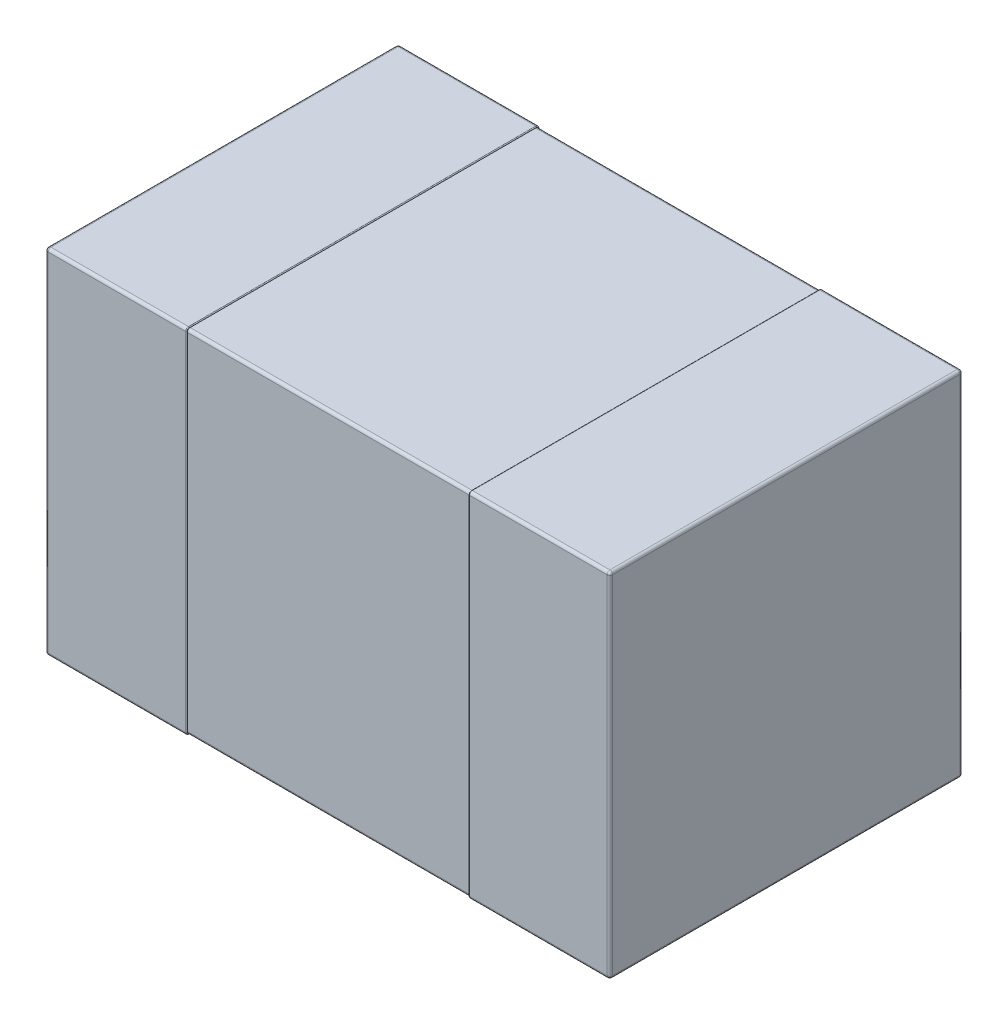
from build123d import *

# Parameters (mm, degrees)
SKETCH1_W                           = 2
SKETCH1_H                           = 1.25
ALL_BODY_DEPTH                      = 1.25
CUT_OUT_THE_BODY_FOR_PIN_DEPTH      = 0.5
CUT_OUT_THE_BODY_FOR_PIN_DEPTH_BACK = 0.5
SKETCH2_OUTSIDE_W                   = 3.784
SKETCH2_OUTSIDE_H                   = 3.784
SKETCH2_OUTSIDE_W_2                 = 1.244
SKETCH2_OUTSIDE_H_2                 = 1.244
BODY_FILLET_R                       = 0.01
PIN_FILLET_A_R                      = 0.01
PIN_FILLET_B_R                      = 0.003


with BuildPart() as part:
    # Sketch1 → All body (new body)
    with BuildSketch(Plane.XY):
        Rectangle(SKETCH1_W, SKETCH1_H)
    extrude(amount=ALL_BODY_DEPTH)

    # Sketch2 outside → Cut out the body for pin (cut, two sides: drawn at the far end of the back side and taken through both)
    with BuildSketch(Plane(origin=(0, 0, 0), x_dir=(0, 0, -1), z_dir=(1, 0, 0)).offset(-CUT_OUT_THE_BODY_FOR_PIN_DEPTH_BACK)):
        with Locations((-0.625, 0)):
            Rectangle(SKETCH2_OUTSIDE_W, SKETCH2_OUTSIDE_H)
        with Locations((-0.625, 0)):
            Rectangle(SKETCH2_OUTSIDE_W_2, SKETCH2_OUTSIDE_H_2, mode=Mode.SUBTRACT)
    extrude(amount=CUT_OUT_THE_BODY_FOR_PIN_DEPTH + CUT_OUT_THE_BODY_FOR_PIN_DEPTH_BACK, mode=Mode.SUBTRACT)

    # Body fillet
    body_fillet_edges = [part.edges().sort_by_distance(p)[0] for p in [
        (0, 0.622, 0.003),
        (0, 0.622, 1.247),
        (0, -0.622, 1.247),
        (0, -0.622, 0.003),
    ]]
    fillet(body_fillet_edges, radius=BODY_FILLET_R)

    # Pin fillet a
    pin_fillet_a_edges = [part.edges().sort_by_distance(p)[0] for p in [
        (1, 0, 1.25),
        (-0.75, 0.625, 0),
        (0.75, -0.625, 0),
        (0.75, -0.625, 1.25),
        (-0.75, 0.625, 1.25),
        (0.75, 0.625, 1.25),
        (-1, 0, 1.25),
        (0.75, 0.625, 0),
        (1, 0, 0),
        (-0.75, -0.625, 0),
        (-1, 0, 0),
        (-1, 0.625, 0.625),
        (1, 0.625, 0.625),
        (1, -0.625, 0.625),
        (-1, -0.625, 0.625),
        (-0.75, -0.625, 1.25),
    ]]
    fillet(pin_fillet_a_edges, radius=PIN_FILLET_A_R)

    # Pin fillet b
    pin_fillet_b_edges = [part.edges().sort_by_distance(p)[0] for p in [
        (0.5, -0.625, 0.625),
        (0.5, 0, 1.25),
        (0.5, 0.625, 0.625),
        (0.5, 0, 0),
        (-0.5, 0.625, 0.625),
        (-0.5, 0, 1.25),
        (-0.5, -0.625, 0.625),
        (-0.5, 0, 0),
        (0.5, 0.622071068, 0.002928932),
        (0.5, -0.622071068, 0.002928932),
        (0.5, -0.622071068, 1.247071068),
        (0.5, 0.622071068, 1.247071068),
        (-0.5, -0.622071068, 1.247071068),
        (-0.5, 0.622071068, 1.247071068),
        (-0.5, -0.622071068, 0.002928932),
        (-0.5, 0.622071068, 0.002928932),
    ]]
    fillet(pin_fillet_b_edges, radius=PIN_FILLET_B_R - 0.0001)  # a hair under: the kernel refuses the full size


solid = part.part
